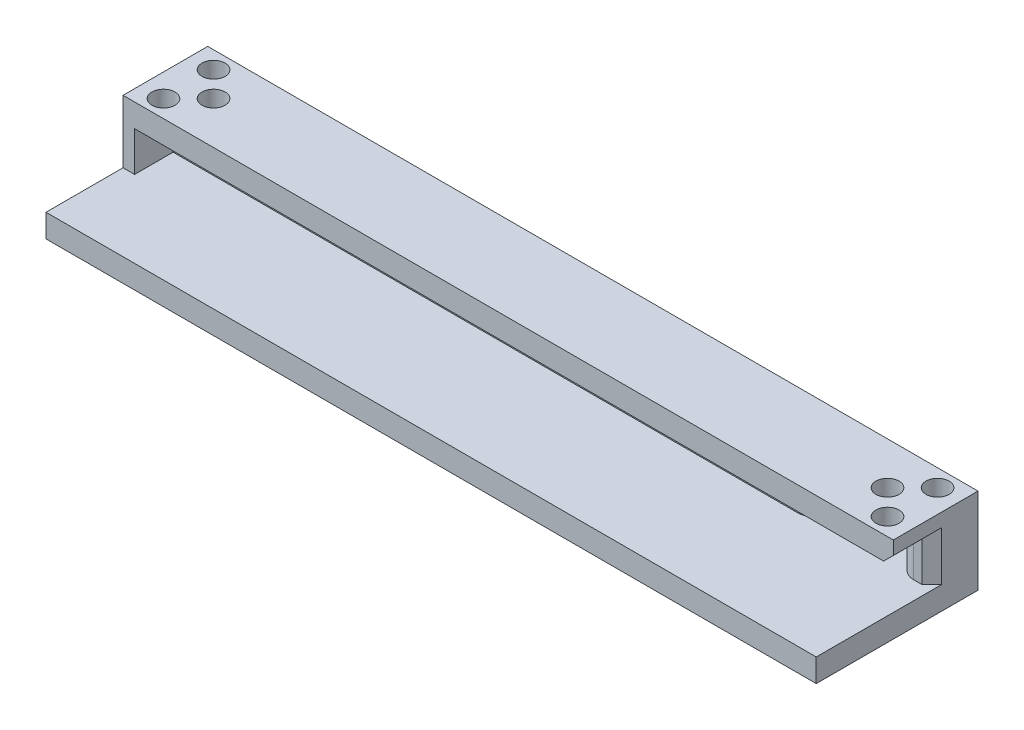
from build123d import *

# Parameters (mm, degrees)
ESBO_O1_W                = 6
ESBO_O1_H                = 5.15
RESSALTO_EXTRUS_O1_DEPTH = 50
CORTE_EXTRUS_O5_START    = -2.575
CORTE_EXTRUS_O5_DEPTH    = 5.15
FILETE2_R                = 2
SKETCH1_W                = 100
SKETCH1_H                = 11
BOSS_EXTRUDE1_DEPTH      = 3
SKETCH2_W                = 100
SKETCH2_H                = 21
BOSS_EXTRUDE2_DEPTH      = 3
FILLET1_R                = 2
FILLET2_R                = 2
CUT_EXTRUDE1_START       = 2.825
CUT_EXTRUDE1_OUTLINE_R   = 1.5
CUT_EXTRUDE1_DEPTH       = 2.75
SKETCH6_W                = 5
SKETCH6_H                = 5.15
BOSS_EXTRUDE4_DEPTH      = 1.5
SKETCH8_R                = 1.5
CUT_EXTRUDE2_DEPTH       = 2.75
CHAMFER2_SIZE            = 1.25


# Read off the part's stored shape, not the designer's step: Corte-extrusão5, Cut-Extrude1
with BuildPart() as part:
    # Esboço1 → Ressalto-extrusão1 (new, symmetric)
    with BuildSketch(Plane(origin=(0, 0, 0), x_dir=(0, 0, -1), z_dir=(1, 0, 0))):
        with Locations((-3, 0)):
            Rectangle(ESBO_O1_W, ESBO_O1_H)
    extrude(amount=RESSALTO_EXTRUS_O1_DEPTH, both=True)

    # Corte-extrusão5 outline → Corte-extrusão5 (cut)
    with BuildSketch(Plane(origin=(0, 0, 0), x_dir=(1, 0, 0), z_dir=(0, 1, 0)).offset(CORTE_EXTRUS_O5_START)):
        Polygon((46, -6), (45, -1.2), (33, -6), align=None)
    extrude(amount=CORTE_EXTRUS_O5_DEPTH, mode=Mode.SUBTRACT)

    # Filete2
    filete2_edges = [part.edges().sort_by_distance(p)[0] for p in [
        (46, 0, 6),
    ]]
    fillet(filete2_edges, radius=FILETE2_R)

    # Sketch1 → Boss-Extrude1 (add)
    with BuildSketch(Plane(origin=(0, 2.575, 0), x_dir=(1, 0, 0), z_dir=(0, 1, 0))):
        with Locations((0, -5.5)):
            Rectangle(SKETCH1_W, SKETCH1_H)
    extrude(amount=BOSS_EXTRUDE1_DEPTH)

    # Sketch2 → Boss-Extrude2 (add)
    with BuildSketch(Plane.XZ.offset(2.575)):
        with Locations((0, 10.5)):
            Rectangle(SKETCH2_W, SKETCH2_H)
    extrude(amount=BOSS_EXTRUDE2_DEPTH)

    # Fillet1
    fillet1_edges = [part.edges().sort_by_distance(p)[0] for p in [
        (45, 0, 1.2),
    ]]
    fillet(fillet1_edges, radius=FILLET1_R)

    # Fillet2
    fillet2_edges = [part.edges().sort_by_distance(p)[0] for p in [
        (33, 0, 6),
    ]]
    fillet(fillet2_edges, radius=FILLET2_R)

    # Cut-Extrude1 outline → Cut-Extrude1 (cut)
    with BuildSketch(Plane(origin=(0, 0, 0), x_dir=(1, 0, 0), z_dir=(0, 1, 0)).offset(CUT_EXTRUDE1_START)):
        with Locations((-43.75, -5.5)):
            Circle(CUT_EXTRUDE1_OUTLINE_R)
        with Locations((43.75, -5.5)):
            Circle(CUT_EXTRUDE1_OUTLINE_R)
        with Locations((47, -2.25)):
            Circle(CUT_EXTRUDE1_OUTLINE_R)
        with Locations((47, -8.75)):
            Circle(CUT_EXTRUDE1_OUTLINE_R)
        with Locations((-47, -8.75)):
            Circle(CUT_EXTRUDE1_OUTLINE_R)
        with Locations((-47, -2.25)):
            Circle(CUT_EXTRUDE1_OUTLINE_R)
    extrude(amount=CUT_EXTRUDE1_DEPTH, mode=Mode.SUBTRACT)

    # Sketch6 → Boss-Extrude4 (add)
    with BuildSketch(Plane.ZY.offset(50)):
        with Locations((8.5, 0)):
            Rectangle(SKETCH6_W, SKETCH6_H)
    extrude(amount=-BOSS_EXTRUDE4_DEPTH)

    # Sketch8 → Cut-Extrude2 (cut)
    with BuildSketch(Plane.XZ.offset(5.575)):
        with Locations(Location((47, 8.75, 0), (0, 0, 90))):
            Circle(SKETCH8_R)
        with Locations(Location((43.75, 5.5, 0), (0, 0, 270))):
            Circle(SKETCH8_R)
        with Locations(Location((47, 2.25, 0), (0, 0, 270))):
            Circle(SKETCH8_R)
        with Locations(Location((-47, 8.75, 0), (0, 0, 270))):
            Circle(SKETCH8_R)
        with Locations(Location((-43.75, 5.5, 0), (0, 0, 90))):
            Circle(SKETCH8_R)
        with Locations(Location((-47, 2.25, 0), (0, 0, 90))):
            Circle(SKETCH8_R)
    extrude(amount=-CUT_EXTRUDE2_DEPTH, mode=Mode.SUBTRACT)

    # Chamfer2
    chamfer2_edges = [part.edges().sort_by_distance(p)[0] for p in [
        (50, 2.575, 8.5),
        (50, 0, 6),
    ]]
    chamfer(chamfer2_edges, length=CHAMFER2_SIZE)


solid = part.part
